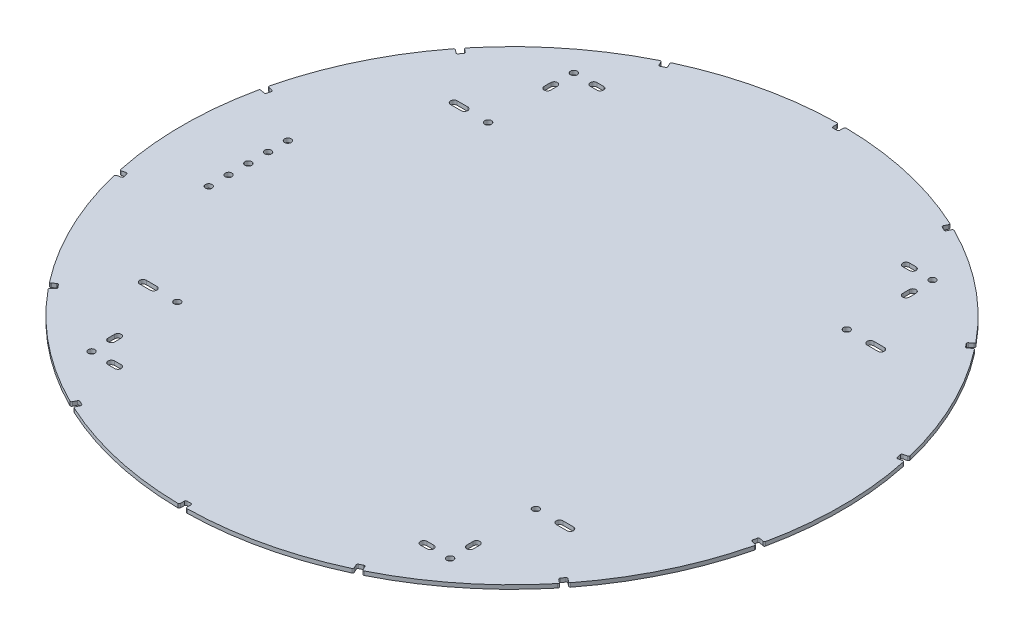
from build123d import *

# Parameters (mm, degrees)
SKETCH1_R                = 250
BOSS_EXTRUDE1_DEPTH      = 3
CUT_EXTRUDE5_DEPTH       = 4
FILLET1_R                = 1
CIRPATTERN1_COUNT        = 14
FILLET1_OF_CIRPATTERN1_R = 1
CUT_EXTRUDE14_DEPTH      = 14
SKETCH22_R               = 2.5
CUT_EXTRUDE16_DEPTH      = 14
CUT_EXTRUDE19_DEPTH      = 4
SKETCH28_R               = 2.5
CUT_EXTRUDE20_DEPTH      = 10


with BuildPart() as part:
    # Sketch1 → Boss-Extrude1 (new body)
    with BuildSketch(Plane(origin=(0, 0, 0), x_dir=(1, 0, 0), z_dir=(0, 1, 0))):
        Circle(SKETCH1_R)
    extrude(amount=BOSS_EXTRUDE1_DEPTH)

    # Sketch11 → Cut-Extrude5 (cut)
    with BuildSketch(Plane(origin=(0, 3, 0), x_dir=(1, 0, 0), z_dir=(0, 1, 0))):
        with BuildLine():
            Line((1.5, 245), (-1.5, 245))
            ThreePointArc((-1.5, 245), (-2.207106781, 245.292893219), (-2.5, 246))
            Line((-2.5, 246), (-2.5, 255))
            Line((-2.5, 255), (2.5, 255))
            Line((2.5, 255), (2.5, 246))
            ThreePointArc((2.5, 246), (2.207106781, 245.292893219), (1.5, 245))
        make_face()
    cut_extrude5 = extrude(amount=-CUT_EXTRUDE5_DEPTH, mode=Mode.SUBTRACT)

    # Fillet1
    fillet1_edges = [part.edges().sort_by_distance(p)[0] for p in [
        (2.5, 1.5, -249.987499687),
        (-2.5, 1.5, -249.987499687),
    ]]
    fillet(fillet1_edges, radius=FILLET1_R)

    # CirPattern1: Cut-Extrude5 ×14 about axis
    cirpattern1_axis = Axis((0, 3, 0), (0, -1, 0))
    for i in range(1, CIRPATTERN1_COUNT):
        add(cut_extrude5.rotate(cirpattern1_axis, i * 360 / CIRPATTERN1_COUNT), mode=Mode.SUBTRACT)

    # Fillet1 of CirPattern1
    fillet1_of_cirpattern1_edges = [part.edges().sort_by_distance(p)[0] for p in [
        (110.717933267, 1.5, -224.146245235),
        (106.213088927, 1.5, -226.315663931),
        (197.006821984, 1.5, -153.910077941),
        (193.889372974, 1.5, -157.819235353),
        (244.276093477, 1.5, -53.190132127),
        (243.163488807, 1.5, -58.064771688),
        (243.163488807, 1.5, 58.064771688),
        (244.276093477, 1.5, 53.190132127),
        (193.889372974, 1.5, 157.819235353),
        (197.006821984, 1.5, 153.910077941),
        (106.213088927, 1.5, 226.315663931),
        (110.717933267, 1.5, 224.146245235),
        (-2.5, 1.5, 249.987499687),
        (2.5, 1.5, 249.987499687),
        (-110.717933267, 1.5, 224.146245235),
        (-106.213088927, 1.5, 226.315663931),
        (-197.006821984, 1.5, 153.910077941),
        (-193.889372974, 1.5, 157.819235353),
        (-244.276093477, 1.5, 53.190132127),
        (-243.163488807, 1.5, 58.064771688),
        (-243.163488807, 1.5, -58.064771688),
        (-244.276093477, 1.5, -53.190132127),
        (-193.889372974, 1.5, -157.819235353),
        (-197.006821984, 1.5, -153.910077941),
        (-106.213088927, 1.5, -226.315663931),
        (-110.717933267, 1.5, -224.146245235),
    ]]
    fillet(fillet1_of_cirpattern1_edges, radius=FILLET1_OF_CIRPATTERN1_R)

    # Sketch20 → Cut-Extrude14 (cut)
    with BuildSketch(Plane.XZ):
        with BuildLine():
            Line((-162, -115.4), (-154, -115.4))
            ThreePointArc((-154, -115.4), (-151.5, -117.9), (-154, -120.4))
            Line((-154, -120.4), (-162, -120.4))
            ThreePointArc((-162, -120.4), (-164.5, -117.9), (-162, -115.4))
        make_face()
        with BuildLine():
            Line((162, -115.4), (154, -115.4))
            ThreePointArc((154, -115.4), (151.5, -117.9), (154, -120.4))
            Line((154, -120.4), (162, -120.4))
            ThreePointArc((162, -120.4), (164.5, -117.9), (162, -115.4))
        make_face()
        with BuildLine():
            Line((162, 115.4), (154, 115.4))
            ThreePointArc((154, 115.4), (151.5, 117.9), (154, 120.4))
            Line((154, 120.4), (162, 120.4))
            ThreePointArc((162, 120.4), (164.5, 117.9), (162, 115.4))
        make_face()
        with BuildLine():
            Line((-162, 115.4), (-154, 115.4))
            ThreePointArc((-154, 115.4), (-151.5, 117.9), (-154, 120.4))
            Line((-154, 120.4), (-162, 120.4))
            ThreePointArc((-162, 120.4), (-164.5, 117.9), (-162, 115.4))
        make_face()
    extrude(amount=-CUT_EXTRUDE14_DEPTH, mode=Mode.SUBTRACT)

    # Sketch22 → Cut-Extrude16 (cut)
    with BuildSketch(Plane(origin=(0, 3, 0), x_dir=(1, 0, 0), z_dir=(0, 1, 0))):
        with Locations((-136, -117.9)):
            Circle(SKETCH22_R)
        with Locations((-136, 117.9)):
            Circle(SKETCH22_R)
        with Locations((136, 117.9)):
            Circle(SKETCH22_R)
        with Locations((136, -117.9)):
            Circle(SKETCH22_R)
        with Locations((-136, 182.9)):
            Circle(SKETCH22_R)
        with Locations((136, 182.9)):
            Circle(SKETCH22_R)
        with Locations((-136, -182.9)):
            Circle(SKETCH22_R)
        with Locations((136, -182.9)):
            Circle(SKETCH22_R)
    extrude(amount=-CUT_EXTRUDE16_DEPTH, mode=Mode.SUBTRACT)

    # Sketch26 → Cut-Extrude19 (cut)
    with BuildSketch(Plane(origin=(0, 3, 0), x_dir=(1, 0, 0), z_dir=(0, 1, 0))):
        with BuildLine():
            Line((-138.5, 162.9), (-138.5, 167.9))
            ThreePointArc((-138.5, 167.9), (-136, 170.4), (-133.5, 167.9))
            Line((-133.5, 167.9), (-133.5, 162.9))
            ThreePointArc((-133.5, 162.9), (-136, 160.4), (-138.5, 162.9))
        make_face()
        with BuildLine():
            Line((-116, 180.4), (-121, 180.4))
            ThreePointArc((-121, 180.4), (-123.5, 182.9), (-121, 185.4))
            Line((-121, 185.4), (-116, 185.4))
            ThreePointArc((-116, 185.4), (-113.5, 182.9), (-116, 180.4))
        make_face()
        with BuildLine():
            Line((116, 180.4), (121, 180.4))
            ThreePointArc((121, 180.4), (123.5, 182.9), (121, 185.4))
            Line((121, 185.4), (116, 185.4))
            ThreePointArc((116, 185.4), (113.5, 182.9), (116, 180.4))
        make_face()
        with BuildLine():
            Line((138.5, 162.9), (138.5, 167.9))
            ThreePointArc((138.5, 167.9), (136, 170.4), (133.5, 167.9))
            Line((133.5, 167.9), (133.5, 162.9))
            ThreePointArc((133.5, 162.9), (136, 160.4), (138.5, 162.9))
        make_face()
        with BuildLine():
            Line((116, -180.4), (121, -180.4))
            ThreePointArc((121, -180.4), (123.5, -182.9), (121, -185.4))
            Line((121, -185.4), (116, -185.4))
            ThreePointArc((116, -185.4), (113.5, -182.9), (116, -180.4))
        make_face()
        with BuildLine():
            Line((138.5, -162.9), (138.5, -167.9))
            ThreePointArc((138.5, -167.9), (136, -170.4), (133.5, -167.9))
            Line((133.5, -167.9), (133.5, -162.9))
            ThreePointArc((133.5, -162.9), (136, -160.4), (138.5, -162.9))
        make_face()
        with BuildLine():
            Line((-138.5, -162.9), (-138.5, -167.9))
            ThreePointArc((-138.5, -167.9), (-136, -170.4), (-133.5, -167.9))
            Line((-133.5, -167.9), (-133.5, -162.9))
            ThreePointArc((-133.5, -162.9), (-136, -160.4), (-138.5, -162.9))
        make_face()
        with BuildLine():
            Line((-116, -180.4), (-121, -180.4))
            ThreePointArc((-121, -180.4), (-123.5, -182.9), (-121, -185.4))
            Line((-121, -185.4), (-116, -185.4))
            ThreePointArc((-116, -185.4), (-113.5, -182.9), (-116, -180.4))
        make_face()
    extrude(amount=-CUT_EXTRUDE19_DEPTH, mode=Mode.SUBTRACT)

    # Sketch28 → Cut-Extrude20 (cut)
    with BuildSketch(Plane(origin=(0, 3, 0), x_dir=(1, 0, 0), z_dir=(0, 1, 0))):
        with Locations((-200, 0)):
            Circle(SKETCH28_R)
        with Locations((-200, -15)):
            Circle(SKETCH28_R)
        with Locations((-200, -30)):
            Circle(SKETCH28_R)
        with Locations((-200, 30)):
            Circle(SKETCH28_R)
        with Locations((-200, 15)):
            Circle(SKETCH28_R)
    extrude(amount=-CUT_EXTRUDE20_DEPTH, mode=Mode.SUBTRACT)


solid = part.part
